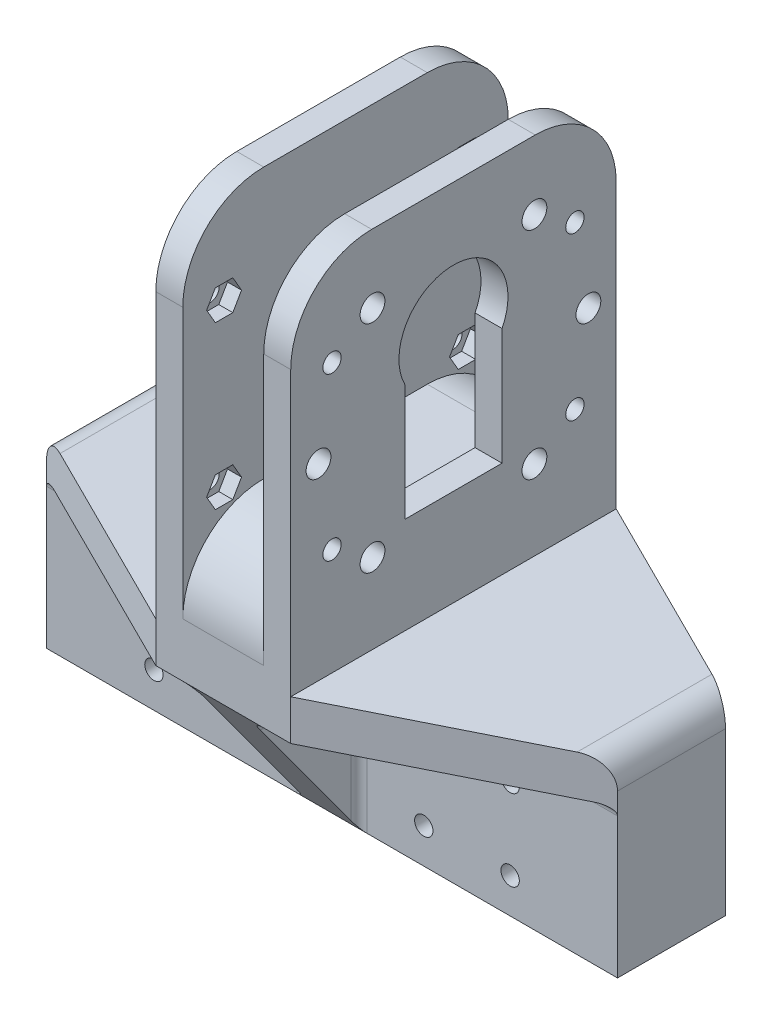
from build123d import *

# Parameters (mm, degrees)
SKETCH1_W                = 105.8
SKETCH1_H                = 20
SKETCH1_W_2              = 26
SKETCH1_H_2              = 11
BOSS_EXTRUDE1_DEPTH      = 30
SKETCH2_W                = 105.8
SKETCH2_H                = 20
BOSS_EXTRUDE2_DEPTH      = 5
CUT_EXTRUDE1_DEPTH       = 16
CUT_EXTRUDE1_DEPTH_BACK  = 5
SKETCH3_R                = 1.7
BOSS_EXTRUDE3_DEPTH      = 7.5
BOSS_EXTRUDE3_DEPTH_BACK = 7.5
SKETCH5_R                = 2.3
SKETCH5_R_2              = 1.7
BOSS_EXTRUDE4_DEPTH      = 5
BOSS_EXTRUDE5_START      = 5
SKETCH6_R                = 1.7
SKETCH6_R_2              = 5
BOSS_EXTRUDE5_DEPTH      = 5
CUT_EXTRUDE2_DEPTH       = 2.7
CUT_EXTRUDE2_DEPTH_BACK  = 2.6
CUT_EXTRUDE3_DEPTH       = 2.7
CUT_EXTRUDE3_DEPTH_BACK  = 2.6
RIB1_REACH               = 98.605
SKETCH10_WALL_W          = 240.355266496
SKETCH10_WALL_H          = 7.5
RIB2_REACH               = 98.605
SKETCH11_WALL_W          = 240.355266496
SKETCH11_WALL_H          = 7.5
RIB3_REACH               = 98.605
SKETCH12_WALL_W          = 240.355266496
SKETCH12_WALL_H          = 7.5
RIB4_REACH               = 98.605
SKETCH13_WALL_W          = 240.355266496
SKETCH13_WALL_H          = 7.5
RIB5_REACH               = 121.221
SKETCH15_WALL_W          = 274.534416958
SKETCH15_WALL_H          = 10
RIB6_REACH               = 121.221
SKETCH16_WALL_W          = 274.534416958
SKETCH16_WALL_H          = 10
CUT_EXTRUDE4_DEPTH       = 2.6
FILLET1_R                = 1.5
FILLET2_R                = 2.5
FILLET3_R                = 5


with BuildPart() as part:
    # Sketch1 → Boss-Extrude1 (new body)
    with BuildSketch(Plane(origin=(0, 0, 0), x_dir=(1, 0, 0), z_dir=(0, 1, 0))):
        Rectangle(SKETCH1_W, SKETCH1_H)
        with Locations((-25, 0)):
            Rectangle(SKETCH1_W_2, SKETCH1_H_2, mode=Mode.SUBTRACT)
        with Locations((25, 0)):
            Rectangle(SKETCH1_W_2, SKETCH1_H_2, mode=Mode.SUBTRACT)
    extrude(amount=BOSS_EXTRUDE1_DEPTH)

    # Sketch2 → Boss-Extrude2 (add)
    with BuildSketch(Plane(origin=(0, 30, 0), x_dir=(1, 0, 0), z_dir=(0, 1, 0))):
        Rectangle(SKETCH2_W, SKETCH2_H)
    extrude(amount=BOSS_EXTRUDE2_DEPTH)

    # Sketch3 → Cut-Extrude1 (cut, two sides: drawn at the far end of the back side and taken through both)
    with BuildSketch(Plane.XY.offset(-5.5).offset(-CUT_EXTRUDE1_DEPTH_BACK)):
        with Locations(Location((-33, 21.5, 0), (0, 0, 180))):
            Circle(SKETCH3_R)
        with Locations(Location((-17, 21.5, 0), (0, 0, 180))):
            Circle(SKETCH3_R)
        with Locations(Location((-33, 6.5, 0), (0, 0, 180))):
            Circle(SKETCH3_R)
        with Locations(Location((-17, 6.5, 0), (0, 0, 180))):
            Circle(SKETCH3_R)
        with Locations(Location((33, 6.5, 0), (0, 0, 180))):
            Circle(SKETCH3_R)
        with Locations(Location((33, 21.5, 0), (0, 0, 180))):
            Circle(SKETCH3_R)
        with Locations(Location((17, 21.5, 0), (0, 0, 180))):
            Circle(SKETCH3_R)
        with Locations(Location((17, 6.5, 0), (0, 0, 180))):
            Circle(SKETCH3_R)
    extrude(amount=CUT_EXTRUDE1_DEPTH + CUT_EXTRUDE1_DEPTH_BACK, mode=Mode.SUBTRACT)

    # Sketch4 → Boss-Extrude3 (add, two sides: drawn at the far end of the back side and taken through both)
    with BuildSketch(Plane(origin=(0, 0, 0), x_dir=(0, 0, -1), z_dir=(1, 0, 0)).offset(-BOSS_EXTRUDE3_DEPTH_BACK)):
        with BuildLine():
            Line((15.15, 52.5), (-15.15, 52.5))
            ThreePointArc((-15.15, 52.5), (-25.756601718, 48.106601718), (-30.15, 37.5))
            Line((-30.15, 37.5), (-30.15, 27.5))
            Line((-30.15, 27.5), (30.15, 27.5))
            Line((30.15, 27.5), (30.15, 37.5))
            ThreePointArc((30.15, 37.5), (25.756601718, 48.106601718), (15.15, 52.5))
        make_face()
    extrude(amount=BOSS_EXTRUDE3_DEPTH + BOSS_EXTRUDE3_DEPTH_BACK)

    # Sketch5 → Boss-Extrude4 (add)
    with BuildSketch(Plane(origin=(7.5, 0, 0), x_dir=(0, 0, -1), z_dir=(1, 0, 0))):
        with BuildLine():
            Line((-30.15, 27.5), (30.15, 27.5))
            Line((30.15, 27.5), (30.15, 87.5))
            ThreePointArc((30.15, 87.5), (25.756601718, 98.106601718), (15.15, 102.5))
            Line((15.15, 102.5), (-15.15, 102.5))
            ThreePointArc((-15.15, 102.5), (-25.756601718, 98.106601718), (-30.15, 87.5))
            Line((-30.15, 87.5), (-30.15, 27.5))
        make_face()
        with Locations((-15, 89.8)):
            Circle(SKETCH5_R, mode=Mode.SUBTRACT)
        with Locations((-22.5, 84.8)):
            Circle(SKETCH5_R_2, mode=Mode.SUBTRACT)
        with Locations((-22.5, 54.8)):
            Circle(SKETCH5_R_2, mode=Mode.SUBTRACT)
        with Locations((-15, 49.8)):
            Circle(SKETCH5_R, mode=Mode.SUBTRACT)
        with Locations((-25, 69.8)):
            Circle(SKETCH5_R, mode=Mode.SUBTRACT)
        with Locations(Location((15, 89.8, 0), (0, 0, 180))):
            Circle(SKETCH5_R, mode=Mode.SUBTRACT)
        with Locations(Location((22.5, 84.8, 0), (0, 0, 180))):
            Circle(SKETCH5_R_2, mode=Mode.SUBTRACT)
        with Locations(Location((25, 69.8, 0), (0, 0, 180))):
            Circle(SKETCH5_R, mode=Mode.SUBTRACT)
        with Locations(Location((22.5, 54.8, 0), (0, 0, 180))):
            Circle(SKETCH5_R_2, mode=Mode.SUBTRACT)
        with Locations(Location((15, 49.8, 0), (0, 0, 180))):
            Circle(SKETCH5_R, mode=Mode.SUBTRACT)
        with BuildLine():
            Line((9, 74.516333345), (9, 52.9))
            Line((9, 52.9), (-9, 52.9))
            Line((-9, 52.9), (-9, 74.516333345))
            ThreePointArc((-9, 74.516333345), (0, 89.2), (9, 74.516333345))
        make_face(mode=Mode.SUBTRACT)
    extrude(amount=BOSS_EXTRUDE4_DEPTH)

    # Sketch6 → Boss-Extrude5 (add)
    with BuildSketch(Plane.ZY.offset(7.5).offset(BOSS_EXTRUDE5_START)):
        with BuildLine():
            Line((-30.15, 27.5), (30.15, 27.5))
            Line((30.15, 27.5), (30.15, 87.5))
            ThreePointArc((30.15, 87.5), (25.756601718, 98.106601718), (15.15, 102.5))
            Line((15.15, 102.5), (-15.15, 102.5))
            ThreePointArc((-15.15, 102.5), (-25.756601718, 98.106601718), (-30.15, 87.5))
            Line((-30.15, 87.5), (-30.15, 27.5))
        make_face()
        with Locations((-22.5, 84.8)):
            Circle(SKETCH6_R, mode=Mode.SUBTRACT)
        with Locations(Location((22.5, 84.8, 0), (0, 0, 180))):
            Circle(SKETCH6_R, mode=Mode.SUBTRACT)
        with Locations(Location((22.5, 54.8, 0), (0, 0, 180))):
            Circle(SKETCH6_R, mode=Mode.SUBTRACT)
        with Locations((-22.5, 54.8)):
            Circle(SKETCH6_R, mode=Mode.SUBTRACT)
        with Locations((0, 79.1)):
            Circle(SKETCH6_R_2, mode=Mode.SUBTRACT)
    extrude(amount=-BOSS_EXTRUDE5_DEPTH)

    # Sketch7 → Cut-Extrude2 (cut, two sides: drawn at the far end of the back side and taken through both)
    with BuildSketch(Plane.ZY.offset(-7.5).offset(-CUT_EXTRUDE2_DEPTH_BACK)):
        Polygon((25.733161507, 54.8), (24.116580754, 57.6), (20.883419246, 57.6), (19.266838493, 54.8), (20.883419246, 52), (24.116580754, 52), align=None)
        Polygon((25.733161507, 84.8), (24.116580754, 87.6), (20.883419246, 87.6), (19.266838493, 84.8), (20.883419246, 82), (24.116580754, 82), align=None)
        Polygon((-19.266838493, 84.8), (-20.883419246, 87.6), (-24.116580754, 87.6), (-25.733161507, 84.8), (-24.116580754, 82), (-20.883419246, 82), align=None)
        Polygon((-19.266838493, 54.8), (-20.883419246, 57.6), (-24.116580754, 57.6), (-25.733161507, 54.8), (-24.116580754, 52), (-20.883419246, 52), align=None)
    extrude(amount=CUT_EXTRUDE2_DEPTH + CUT_EXTRUDE2_DEPTH_BACK, mode=Mode.SUBTRACT)

    # Sketch8 → Cut-Extrude3 (cut, two sides: drawn at the far end of the back side and taken through both)
    with BuildSketch(Plane(origin=(-7.5, 0, 0), x_dir=(0, 0, -1), z_dir=(1, 0, 0)).offset(-CUT_EXTRUDE3_DEPTH_BACK)):
        Polygon((-19.266838493, 84.8), (-20.883419246, 87.6), (-24.116580754, 87.6), (-25.733161507, 84.8), (-24.116580754, 82), (-20.883419246, 82), align=None)
        Polygon((25.733161507, 84.8), (24.116580754, 87.6), (20.883419246, 87.6), (19.266838493, 84.8), (20.883419246, 82), (24.116580754, 82), align=None)
        Polygon((25.733161507, 54.8), (24.116580754, 57.6), (20.883419246, 57.6), (19.266838493, 54.8), (20.883419246, 52), (24.116580754, 52), align=None)
        Polygon((-19.266838493, 54.8), (-20.883419246, 57.6), (-24.116580754, 57.6), (-25.733161507, 54.8), (-24.116580754, 52), (-20.883419246, 52), align=None)
    extrude(amount=CUT_EXTRUDE3_DEPTH + CUT_EXTRUDE3_DEPTH_BACK, mode=Mode.SUBTRACT)

    # Sketch10 wall → Rib1 (add, up to next)
    with BuildSketch(Plane(origin=(32.7, 27.5, -20.075), x_dir=(0.894869756994, 0, 0.446327366422), z_dir=(-0.446327366422, 0, 0.894869756994)), mode=Mode.PRIVATE) as rib1_sk1:
        with Locations((0, 3.75)):
            Rectangle(SKETCH10_WALL_W, SKETCH10_WALL_H)
    rib1_tool1 = extrude(rib1_sk1.sketch, amount=RIB1_REACH, mode=Mode.PRIVATE) - part.part
    add(rib1_tool1.solids().sort_by_distance((32.7, 27.5, -20.075))[0])

    # Sketch11 wall → Rib2 (add, up to next)
    with BuildSketch(Plane(origin=(-32.7, 27.5, -20.075), x_dir=(-0.894869756994, 0, 0.446327366422), z_dir=(-0.446327366422, 0, -0.894869756994)), mode=Mode.PRIVATE) as rib2_sk1:
        with Locations((0, 3.75)):
            Rectangle(SKETCH11_WALL_W, SKETCH11_WALL_H)
    rib2_tool1 = extrude(rib2_sk1.sketch, amount=-RIB2_REACH, mode=Mode.PRIVATE) - part.part
    add(rib2_tool1.solids().sort_by_distance((-32.7, 27.5, -20.075))[0])

    # Sketch12 wall → Rib3 (add, up to next)
    with BuildSketch(Plane(origin=(32.7, 27.5, 20.075), x_dir=(0.894869756994, 0, -0.446327366422), z_dir=(0.446327366422, 0, 0.894869756994)), mode=Mode.PRIVATE) as rib3_sk1:
        with Locations((0, 3.75)):
            Rectangle(SKETCH12_WALL_W, SKETCH12_WALL_H)
    rib3_tool1 = extrude(rib3_sk1.sketch, amount=-RIB3_REACH, mode=Mode.PRIVATE) - part.part
    add(rib3_tool1.solids().sort_by_distance((32.7, 27.5, 20.075))[0])

    # Sketch13 wall → Rib4 (add, up to next)
    with BuildSketch(Plane(origin=(-32.7, 27.5, 20.075), x_dir=(-0.894869756994, 0, -0.446327366422), z_dir=(0.446327366422, 0, -0.894869756994)), mode=Mode.PRIVATE) as rib4_sk1:
        with Locations((0, 3.75)):
            Rectangle(SKETCH13_WALL_W, SKETCH13_WALL_H)
    rib4_tool1 = extrude(rib4_sk1.sketch, amount=RIB4_REACH, mode=Mode.PRIVATE) - part.part
    add(rib4_tool1.solids().sort_by_distance((-32.7, 27.5, 20.075))[0])

    # Sketch15 wall → Rib5 (add, up to next)
    with BuildSketch(Plane(origin=(0, 13.75, -20.075), x_dir=(0, -0.80663806558, 0.591045709871), z_dir=(0, -0.591045709871, -0.80663806558)), mode=Mode.PRIVATE) as rib5_sk1:
        Rectangle(SKETCH15_WALL_W, SKETCH15_WALL_H)
    rib5_tool1 = extrude(rib5_sk1.sketch, amount=-RIB5_REACH, mode=Mode.PRIVATE) - part.part
    add(rib5_tool1.solids().sort_by_distance((0, 13.75, -20.075))[0])

    # Sketch16 wall → Rib6 (add, up to next)
    with BuildSketch(Plane(origin=(0, 13.75, 20.075), x_dir=(0, -0.80663806558, -0.591045709871), z_dir=(0, 0.591045709871, -0.80663806558)), mode=Mode.PRIVATE) as rib6_sk1:
        Rectangle(SKETCH16_WALL_W, SKETCH16_WALL_H)
    rib6_tool1 = extrude(rib6_sk1.sketch, amount=RIB6_REACH, mode=Mode.PRIVATE) - part.part
    add(rib6_tool1.solids().sort_by_distance((0, 13.75, 20.075))[0])

    # Sketch17 → Cut-Extrude4 (cut)
    with BuildSketch(Plane(origin=(0, 0, -10), x_dir=(-1, 0, 0), z_dir=(0, 0, -1))):
        Polygon((36.233161507, 21.5), (34.616580754, 24.3), (31.383419246, 24.3), (29.766838493, 21.5), (31.383419246, 18.7), (34.616580754, 18.7), align=None)
        Polygon((36.233161507, 6.5), (34.616580754, 9.3), (31.383419246, 9.3), (29.766838493, 6.5), (31.383419246, 3.7), (34.616580754, 3.7), align=None)
        Polygon((15.383419246, 18.7), (13.766838493, 21.5), (15.383419246, 24.3), (18.616580754, 24.3), (20.233161507, 21.5), (18.616580754, 18.7), align=None)
        Polygon((15.383419246, 3.7), (13.766838493, 6.5), (15.383419246, 9.3), (18.616580754, 9.3), (20.233161507, 6.5), (18.616580754, 3.7), align=None)
        Polygon((-34.616580754, 3.7), (-36.233161507, 6.5), (-34.616580754, 9.3), (-31.383419246, 9.3), (-29.766838493, 6.5), (-31.383419246, 3.7), align=None)
        Polygon((-34.616580754, 18.7), (-36.233161507, 21.5), (-34.616580754, 24.3), (-31.383419246, 24.3), (-29.766838493, 21.5), (-31.383419246, 18.7), align=None)
        Polygon((-18.616580754, 18.7), (-15.383419246, 18.7), (-13.766838493, 21.5), (-15.383419246, 24.3), (-18.616580754, 24.3), (-20.233161507, 21.5), align=None)
        Polygon((-18.616580754, 3.7), (-15.383419246, 3.7), (-13.766838493, 6.5), (-15.383419246, 9.3), (-18.616580754, 9.3), (-20.233161507, 6.5), align=None)
    extrude(amount=-CUT_EXTRUDE4_DEPTH, mode=Mode.SUBTRACT)

    # Fillet1
    fillet1_edges = [part.edges().sort_by_distance(p)[0] for p in [
        (-28.95, 27.5, -10),
        (28.95, 27.5, 10),
        (28.95, 27.5, -10),
        (-5, 13.75, -10),
        (5, 13.75, -10),
        (-28.95, 27.5, 10),
        (-5, 13.75, 10),
        (5, 13.75, 10),
    ]]
    fillet(fillet1_edges, radius=FILLET1_R)

    # Fillet2
    # the kernel refuses this fillet: 2.5 mm, written as the material it adds along each edge
    with BuildSketch(Plane(origin=(-7.5, 25, -10), x_dir=(1, 0, 0), z_dir=(0, -1, 0))) as fillet2_piece_1:
        with BuildLine():
            CenterArc((1, -1.5), 1.5, 0, 90)
            Line((2.5, -1.5), (2.5, 0))
            Line((2.5, 0), (1, 0))
        make_face()
    revolve(axis=Axis((-7.5, 25, -10), (0, 0, 1)), revolution_arc=90)
    with BuildSketch(Plane(origin=(7.5, 25, -10), x_dir=(0, 1, 0), z_dir=(1, 0, 0))) as fillet2_piece_2:
        with BuildLine():
            CenterArc((1, -1.5), 1.5, 0, 90)
            Line((2.5, -1.5), (2.5, 0))
            Line((2.5, 0), (1, 0))
        make_face()
    revolve(axis=Axis((7.5, 25, -10), (0, 0, 1)), revolution_arc=90)
    with BuildSketch(Plane(origin=(-7.5, 25, 10), x_dir=(0, 1, 0), z_dir=(-1, 0, 0))) as fillet2_piece_3:
        with BuildLine():
            CenterArc((1, -1.5), 1.5, 0, 90)
            Line((2.5, -1.5), (2.5, 0))
            Line((2.5, 0), (1, 0))
        make_face()
    revolve(axis=Axis((-7.5, 25, 10), (0, 0, -1)), revolution_arc=90)
    with BuildSketch(Plane(origin=(7.5, 25, 10), x_dir=(-1, 0, 0), z_dir=(0, -1, 0))) as fillet2_piece_4:
        with BuildLine():
            CenterArc((1, -1.5), 1.5, 0, 90)
            Line((2.5, -1.5), (2.5, 0))
            Line((2.5, 0), (1, 0))
        make_face()
    revolve(axis=Axis((7.5, 25, 10), (0, 0, -1)), revolution_arc=90)
    with BuildSketch(Plane(origin=(-5, 27.5, 10), x_dir=(0, -1, 0), z_dir=(0, 0, 1))) as fillet2_piece_5_section:
        with BuildLine():
            CenterArc((FILLET2_R, -FILLET2_R), FILLET2_R, 90, 90)
            Line((0, -FILLET2_R), (0, 0))
            Line((0, 0), (FILLET2_R, 0))
        make_face()
    fillet2_piece_5 = extrude(amount=20.15, mode=Mode.PRIVATE)
    fillet2_piece_5 = split(fillet2_piece_5, bisect_by=Plane(origin=(-5.572310612, 22.238023523, 26.294406327), z_dir=(0, 0.5910457098711305, -0.806638065580178)), keep=Keep.TOP, mode=Mode.PRIVATE)
    add(fillet2_piece_5)
    with BuildSketch(Plane(origin=(5, 27.5, 30.15), x_dir=(0, -1, 0), z_dir=(0, 0, -1))) as fillet2_piece_6_section:
        with BuildLine():
            CenterArc((FILLET2_R, -FILLET2_R), FILLET2_R, 90, 90)
            Line((0, -FILLET2_R), (0, 0))
            Line((0, 0), (FILLET2_R, 0))
        make_face()
    fillet2_piece_6 = extrude(amount=20.15, mode=Mode.PRIVATE)
    fillet2_piece_6 = split(fillet2_piece_6, bisect_by=Plane(origin=(5.572310612, 22.238023523, 26.294406327), z_dir=(0, 0.5910457098711305, -0.806638065580178)), keep=Keep.TOP, mode=Mode.PRIVATE)
    add(fillet2_piece_6)
    with BuildSketch(Plane(origin=(5, 27.5, -10), x_dir=(1, 0, 0), z_dir=(0, 0, -1))) as fillet2_piece_7_section:
        with BuildLine():
            CenterArc((FILLET2_R, FILLET2_R), FILLET2_R, 180, 90)
            Line((0, FILLET2_R), (0, 0))
            Line((0, 0), (FILLET2_R, 0))
        make_face()
    fillet2_piece_7 = extrude(amount=20.15, mode=Mode.PRIVATE)
    fillet2_piece_7 = split(fillet2_piece_7, bisect_by=Plane(origin=(5.572310612, 22.238023523, -26.294406327), z_dir=(0, 0.5910457098711305, 0.806638065580178)), keep=Keep.TOP, mode=Mode.PRIVATE)
    add(fillet2_piece_7)
    with BuildSketch(Plane(origin=(-5, 27.5, -30.15), x_dir=(0, -1, 0), z_dir=(0, 0, 1))) as fillet2_piece_8_section:
        with BuildLine():
            CenterArc((FILLET2_R, -FILLET2_R), FILLET2_R, 90, 90)
            Line((0, -FILLET2_R), (0, 0))
            Line((0, 0), (FILLET2_R, 0))
        make_face()
    fillet2_piece_8 = extrude(amount=20.15, mode=Mode.PRIVATE)
    fillet2_piece_8 = split(fillet2_piece_8, bisect_by=Plane(origin=(-5.572310612, 22.238023523, -26.294406327), z_dir=(0, 0.5910457098711305, 0.806638065580178)), keep=Keep.TOP, mode=Mode.PRIVATE)
    add(fillet2_piece_8)

    # Fillet3
    fillet3_edges = [part.edges().sort_by_distance(p)[0] for p in [
        (-52.9, 35, 0),
        (52.9, 35, 0),
    ]]
    fillet(fillet3_edges, radius=FILLET3_R)


solid = part.part
